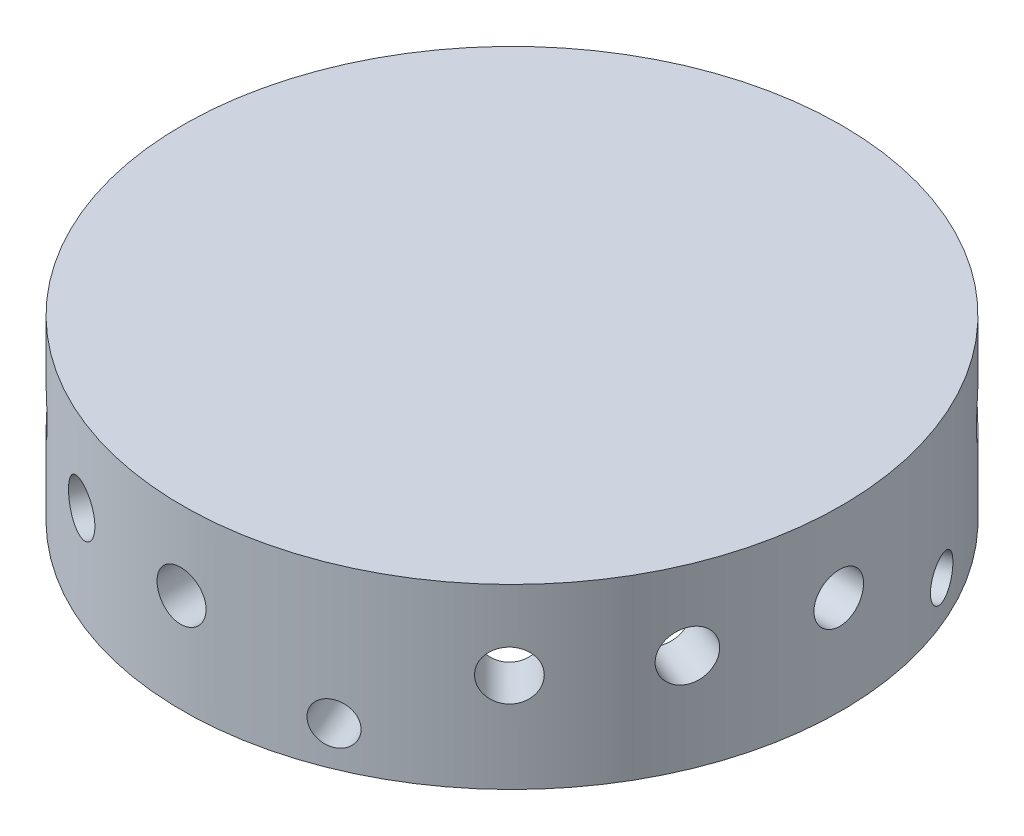
from build123d import *

# Parameters (mm, degrees)
WYTNIJ_WYCI_GNI_CIE5_REACH   = 201.702
SZKIC2_R                     = 6.25
SZYK_KO_OWY3_COUNT           = 3
SZYK_KO_OWY3_ANGLE           = 45
SZYK_KO_OWY4_COPY_1_REACH    = 201.702
SZYK_KO_OWY4_COPY_1_SKETCH_R = 6.25
SZYK_KO_OWY4_COPY_2_REACH    = 201.702
SZYK_KO_OWY4_COPY_2_SKETCH_R = 6.25
SZYK_KO_OWY4_COPY_3_REACH    = 201.702
SZYK_KO_OWY4_COPY_3_SKETCH_R = 6.25
SZYK_KO_OWY4_COPY_4_REACH    = 201.702
SZYK_KO_OWY4_COPY_4_SKETCH_R = 6.25
SZYK_KO_OWY4_COPY_5_REACH    = 201.702
SZYK_KO_OWY4_COPY_5_SKETCH_R = 6.25
SZYK_KO_OWY4_COPY_6_REACH    = 201.702
SZYK_KO_OWY4_COPY_6_SKETCH_R = 6.25
SZYK_KO_OWY4_COPY_7_REACH    = 201.702
SZYK_KO_OWY4_COPY_7_SKETCH_R = 6.25
SZYK_KO_OWY4_COPY_8_REACH    = 201.702
SZYK_KO_OWY4_COPY_8_SKETCH_R = 6.25
SZYK_KO_OWY4_COPY_9_REACH    = 201.702
SZYK_KO_OWY4_COPY_9_SKETCH_R = 6.25
SZKIC7_R                     = 5.25
WYTNIJ_WYCI_GNI_CIE6_DEPTH   = 20
SZYK_KO_OWY5_COUNT           = 4


with BuildPart() as part:
    # Szkic1 → Obrót1 (revolve)
    with BuildSketch(Plane.XY):
        Polygon((0, 70.848451872), (-83.5, 70.848451872), (-83.5, 40.848451872), (-83.5, 25.848451872), (-70.5, 25.848451872), (-70.5, 65.848451872), (0, 65.848451872), align=None)
    revolve(axis=Axis((0, -200.62943078, 0), (0, 1, 0)))

    # Szkic2 → Wytnij-wyciągnięcie5 (cut, up to next)
    with BuildSketch(Plane(origin=(83.5, 0, 0), x_dir=(0, 0, -1), z_dir=(1, 0, 0)), mode=Mode.PRIVATE) as wytnij_wyci_gni_cie5_sk1:
        with Locations((-0.467069002, 50.848451872)):
            Circle(SZKIC2_R)
    wytnij_wyci_gni_cie5_tool1 = extrude(wytnij_wyci_gni_cie5_sk1.sketch, amount=-WYTNIJ_WYCI_GNI_CIE5_REACH, mode=Mode.PRIVATE) & part.part
    wytnij_wyci_gni_cie5 = wytnij_wyci_gni_cie5_tool1.solids().sort_by_distance((83.5, 50.848452, 0.467069))[0]
    add(wytnij_wyci_gni_cie5, mode=Mode.SUBTRACT)

    # Szyk kołowy3: Wytnij-wyciągnięcie5 ×3 about axis
    szyk_ko_owy3_axis = Axis((0, -200.62943078, 0), (0, -1, 0))
    for i in range(1, SZYK_KO_OWY3_COUNT):
        add(wytnij_wyci_gni_cie5.rotate(szyk_ko_owy3_axis, i * SZYK_KO_OWY3_ANGLE / (SZYK_KO_OWY3_COUNT - 1)), mode=Mode.SUBTRACT)

    # Szyk kołowy4 copy 1 sketch → Szyk kołowy4 copy 1 (cut, up to next)
    with BuildSketch(Plane(origin=(-31.954066602, 0, 77.143940965), x_dir=(0.9238795325112864, 0, 0.3826834323650905), z_dir=(-0.3826834323650905, 0, 0.9238795325112864)), mode=Mode.PRIVATE) as szyk_ko_owy4_copy_1_sk1:
        with Locations((-0.467069002, 50.848451872)):
            Circle(SZYK_KO_OWY4_COPY_1_SKETCH_R)
    szyk_ko_owy4_copy_1_tool1 = extrude(szyk_ko_owy4_copy_1_sk1.sketch, amount=-SZYK_KO_OWY4_COPY_1_REACH, mode=Mode.PRIVATE) & part.part
    add(szyk_ko_owy4_copy_1_tool1.solids().sort_by_distance((-32.385582092, 50.848452, 76.965201397))[0], mode=Mode.SUBTRACT)

    # Szyk kołowy4 copy 2 sketch → Szyk kołowy4 copy 2 (cut, up to next)
    with BuildSketch(Plane(origin=(-77.143940965, 0, -31.954066602), x_dir=(-0.38268343236509045, 0, 0.9238795325112864), z_dir=(-0.9238795325112864, 0, -0.38268343236509045)), mode=Mode.PRIVATE) as szyk_ko_owy4_copy_2_sk1:
        with Locations((-0.467069002, 50.848451872)):
            Circle(SZYK_KO_OWY4_COPY_2_SKETCH_R)
    szyk_ko_owy4_copy_2_tool1 = extrude(szyk_ko_owy4_copy_2_sk1.sketch, amount=-SZYK_KO_OWY4_COPY_2_REACH, mode=Mode.PRIVATE) & part.part
    add(szyk_ko_owy4_copy_2_tool1.solids().sort_by_distance((-76.965201397, 50.848452, -32.385582092))[0], mode=Mode.SUBTRACT)

    # Szyk kołowy4 copy 3 sketch → Szyk kołowy4 copy 3 (cut, up to next)
    with BuildSketch(Plane(origin=(31.954066602, 0, -77.143940965), x_dir=(-0.9238795325112865, 0, -0.3826834323650904), z_dir=(0.3826834323650904, 0, -0.9238795325112865)), mode=Mode.PRIVATE) as szyk_ko_owy4_copy_3_sk1:
        with Locations((-0.467069002, 50.848451872)):
            Circle(SZYK_KO_OWY4_COPY_3_SKETCH_R)
    szyk_ko_owy4_copy_3_tool1 = extrude(szyk_ko_owy4_copy_3_sk1.sketch, amount=-SZYK_KO_OWY4_COPY_3_REACH, mode=Mode.PRIVATE) & part.part
    add(szyk_ko_owy4_copy_3_tool1.solids().sort_by_distance((32.385582092, 50.848452, -76.965201397))[0], mode=Mode.SUBTRACT)

    # Szyk kołowy4 copy 4 sketch → Szyk kołowy4 copy 4 (cut, up to next)
    with BuildSketch(Plane(origin=(-59.043416229, 0, 59.043416229), x_dir=(0.7071067811865462, 0, 0.7071067811865488), z_dir=(-0.7071067811865488, 0, 0.7071067811865462)), mode=Mode.PRIVATE) as szyk_ko_owy4_copy_4_sk1:
        with Locations((-0.467069002, 50.848451872)):
            Circle(SZYK_KO_OWY4_COPY_4_SKETCH_R)
    szyk_ko_owy4_copy_4_tool1 = extrude(szyk_ko_owy4_copy_4_sk1.sketch, amount=-SZYK_KO_OWY4_COPY_4_REACH, mode=Mode.PRIVATE) & part.part
    add(szyk_ko_owy4_copy_4_tool1.solids().sort_by_distance((-59.373683886, 50.848452, 58.713148572))[0], mode=Mode.SUBTRACT)

    # Szyk kołowy4 copy 5 sketch → Szyk kołowy4 copy 5 (cut, up to next)
    with BuildSketch(Plane(origin=(-59.043416229, 0, -59.043416229), x_dir=(-0.7071067811865487, 0, 0.7071067811865464), z_dir=(-0.7071067811865464, 0, -0.7071067811865487)), mode=Mode.PRIVATE) as szyk_ko_owy4_copy_5_sk1:
        with Locations((-0.467069002, 50.848451872)):
            Circle(SZYK_KO_OWY4_COPY_5_SKETCH_R)
    szyk_ko_owy4_copy_5_tool1 = extrude(szyk_ko_owy4_copy_5_sk1.sketch, amount=-SZYK_KO_OWY4_COPY_5_REACH, mode=Mode.PRIVATE) & part.part
    add(szyk_ko_owy4_copy_5_tool1.solids().sort_by_distance((-58.713148572, 50.848452, -59.373683886))[0], mode=Mode.SUBTRACT)

    # Szyk kołowy4 copy 6 sketch → Szyk kołowy4 copy 6 (cut, up to next)
    with BuildSketch(Plane(origin=(59.043416229, 0, -59.043416229), x_dir=(-0.7071067811865464, 0, -0.7071067811865487), z_dir=(0.7071067811865487, 0, -0.7071067811865464)), mode=Mode.PRIVATE) as szyk_ko_owy4_copy_6_sk1:
        with Locations((-0.467069002, 50.848451872)):
            Circle(SZYK_KO_OWY4_COPY_6_SKETCH_R)
    szyk_ko_owy4_copy_6_tool1 = extrude(szyk_ko_owy4_copy_6_sk1.sketch, amount=-SZYK_KO_OWY4_COPY_6_REACH, mode=Mode.PRIVATE) & part.part
    add(szyk_ko_owy4_copy_6_tool1.solids().sort_by_distance((59.373683886, 50.848452, -58.713148572))[0], mode=Mode.SUBTRACT)

    # Szyk kołowy4 copy 7 sketch → Szyk kołowy4 copy 7 (cut, up to next)
    with BuildSketch(Plane.XY.offset(83.5), mode=Mode.PRIVATE) as szyk_ko_owy4_copy_7_sk1:
        with Locations((-0.467069002, 50.848451872)):
            Circle(SZYK_KO_OWY4_COPY_7_SKETCH_R)
    szyk_ko_owy4_copy_7_tool1 = extrude(szyk_ko_owy4_copy_7_sk1.sketch, amount=-SZYK_KO_OWY4_COPY_7_REACH, mode=Mode.PRIVATE) & part.part
    add(szyk_ko_owy4_copy_7_tool1.solids().sort_by_distance((-0.467069, 50.848452, 83.5))[0], mode=Mode.SUBTRACT)

    # Szyk kołowy4 copy 8 sketch → Szyk kołowy4 copy 8 (cut, up to next)
    with BuildSketch(Plane.ZY.offset(83.5), mode=Mode.PRIVATE) as szyk_ko_owy4_copy_8_sk1:
        with Locations((-0.467069002, 50.848451872)):
            Circle(SZYK_KO_OWY4_COPY_8_SKETCH_R)
    szyk_ko_owy4_copy_8_tool1 = extrude(szyk_ko_owy4_copy_8_sk1.sketch, amount=-SZYK_KO_OWY4_COPY_8_REACH, mode=Mode.PRIVATE) & part.part
    add(szyk_ko_owy4_copy_8_tool1.solids().sort_by_distance((-83.5, 50.848452, -0.467069))[0], mode=Mode.SUBTRACT)

    # Szyk kołowy4 copy 9 sketch → Szyk kołowy4 copy 9 (cut, up to next)
    with BuildSketch(Plane(origin=(0, 0, -83.5), x_dir=(-1, 0, 0), z_dir=(0, 0, -1)), mode=Mode.PRIVATE) as szyk_ko_owy4_copy_9_sk1:
        with Locations((-0.467069002, 50.848451872)):
            Circle(SZYK_KO_OWY4_COPY_9_SKETCH_R)
    szyk_ko_owy4_copy_9_tool1 = extrude(szyk_ko_owy4_copy_9_sk1.sketch, amount=-SZYK_KO_OWY4_COPY_9_REACH, mode=Mode.PRIVATE) & part.part
    add(szyk_ko_owy4_copy_9_tool1.solids().sort_by_distance((0.467069, 50.848452, -83.5))[0], mode=Mode.SUBTRACT)

    # Szkic7 → Wytnij-wyciągnięcie6 (cut)
    with BuildSketch(Plane(origin=(-31.954066602, 0, -77.143940965), x_dir=(0, -1, 0), z_dir=(-0.38268343236508734, 0, -0.9238795325112877))):
        with Locations((-35.848451872, 0)):
            Circle(SZKIC7_R)
    wytnij_wyci_gni_cie6 = extrude(amount=-WYTNIJ_WYCI_GNI_CIE6_DEPTH, mode=Mode.SUBTRACT)

    # Szyk kołowy5: Wytnij-wyciągnięcie6 ×4 about axis
    szyk_ko_owy5_axis = Axis((0, -200.62943078, 0), (0, -1, 0))
    for i in range(1, SZYK_KO_OWY5_COUNT):
        add(wytnij_wyci_gni_cie6.rotate(szyk_ko_owy5_axis, i * 360 / SZYK_KO_OWY5_COUNT), mode=Mode.SUBTRACT)


solid = part.part
